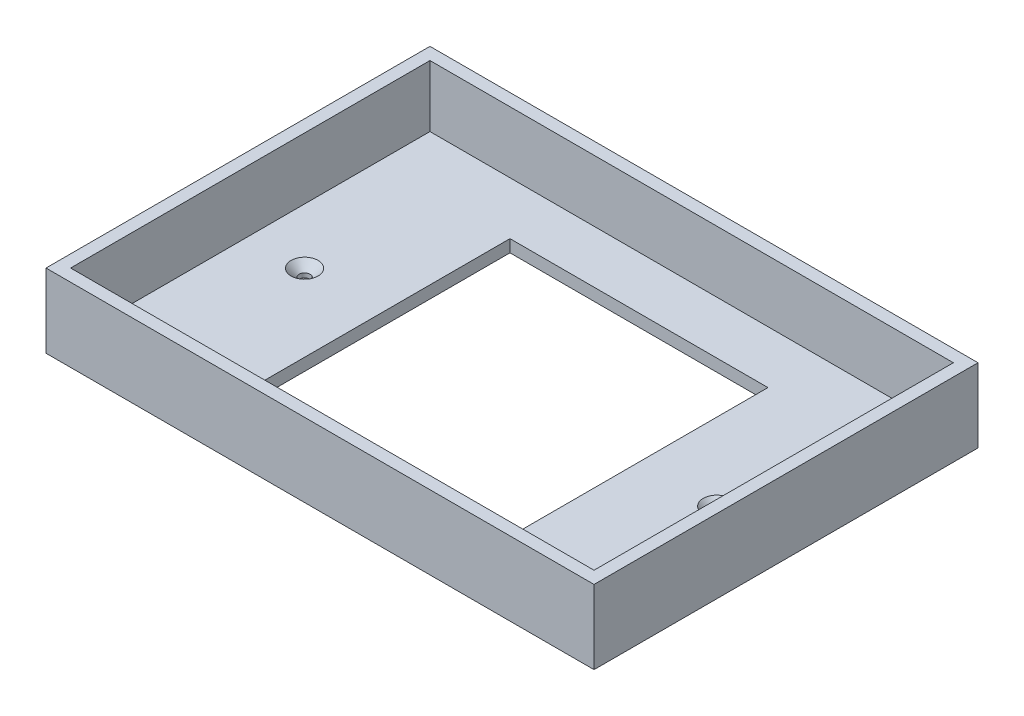
from build123d import *

# Parameters (mm, degrees)
SKETCH1_W                                       = 89.09
SKETCH1_H                                       = 62.42
BOSS_EXTRUDE1_DEPTH                             = 2
SKETCH1_3_W                                     = 89.09
SKETCH1_3_H                                     = 62.42
SKETCH1_3_W_2                                   = 85.09
SKETCH1_3_H_2                                   = 58.42
BOSS_EXTRUDE2_DEPTH                             = 10
CSK_FOR_M2_FLAT_HEAD_MACHINE_SCREW1_D           = 1.8
CSK_FOR_M2_FLAT_HEAD_MACHINE_SCREW1_DEPTH       = 9.906
CSK_FOR_M2_FLAT_HEAD_MACHINE_SCREW1_CSINK_D     = 4.4
CSK_FOR_M2_FLAT_HEAD_MACHINE_SCREW1_CSINK_ANGLE = 90
CSK_FOR_M2_FLAT_HEAD_MACHINE_SCREW1_TIP         = 0.540774557
SKETCH7_W                                       = 41.935160688
SKETCH7_H                                       = 41.279429724
CUT_EXTRUDE1_DEPTH                              = 2.54


with BuildPart() as part:
    # Sketch1 → Boss-Extrude1 (new body)
    with BuildSketch(Plane(origin=(0, 0, 0), x_dir=(1, 0, 0), z_dir=(0, 1, 0))):
        Rectangle(SKETCH1_W, SKETCH1_H)
    extrude(amount=-BOSS_EXTRUDE1_DEPTH)

    # Sketch1<3> → Boss-Extrude2 (add)
    with BuildSketch(Plane(origin=(0, 0, 0), x_dir=(1, 0, 0), z_dir=(0, 1, 0))):
        Rectangle(SKETCH1_3_W, SKETCH1_3_H)
        Rectangle(SKETCH1_3_W_2, SKETCH1_3_H_2, mode=Mode.SUBTRACT)
    extrude(amount=BOSS_EXTRUDE2_DEPTH)

    # CSK for M2 Flat Head Machine Screw1
    with Locations(Plane(origin=(0, 0, 0), x_dir=(1, 0, 0), z_dir=(0, 1, 0))):
        with Locations((-33.5, -0.21892606), (33.5, -0.21892606)):
            CounterSinkHole(CSK_FOR_M2_FLAT_HEAD_MACHINE_SCREW1_D / 2, CSK_FOR_M2_FLAT_HEAD_MACHINE_SCREW1_CSINK_D / 2, depth=CSK_FOR_M2_FLAT_HEAD_MACHINE_SCREW1_DEPTH, counter_sink_angle=CSK_FOR_M2_FLAT_HEAD_MACHINE_SCREW1_CSINK_ANGLE)
            with Locations((0, 0, -(CSK_FOR_M2_FLAT_HEAD_MACHINE_SCREW1_DEPTH + CSK_FOR_M2_FLAT_HEAD_MACHINE_SCREW1_TIP / 2))):  # 118° drill point
                Cone(0, CSK_FOR_M2_FLAT_HEAD_MACHINE_SCREW1_D / 2, CSK_FOR_M2_FLAT_HEAD_MACHINE_SCREW1_TIP, mode=Mode.SUBTRACT)

    # Sketch7 → Cut-Extrude1 (cut)
    with BuildSketch(Plane(origin=(0, 0, 0), x_dir=(1, 0, 0), z_dir=(0, 1, 0))):
        Rectangle(SKETCH7_W, SKETCH7_H)
    extrude(amount=-CUT_EXTRUDE1_DEPTH, mode=Mode.SUBTRACT)


solid = part.part
